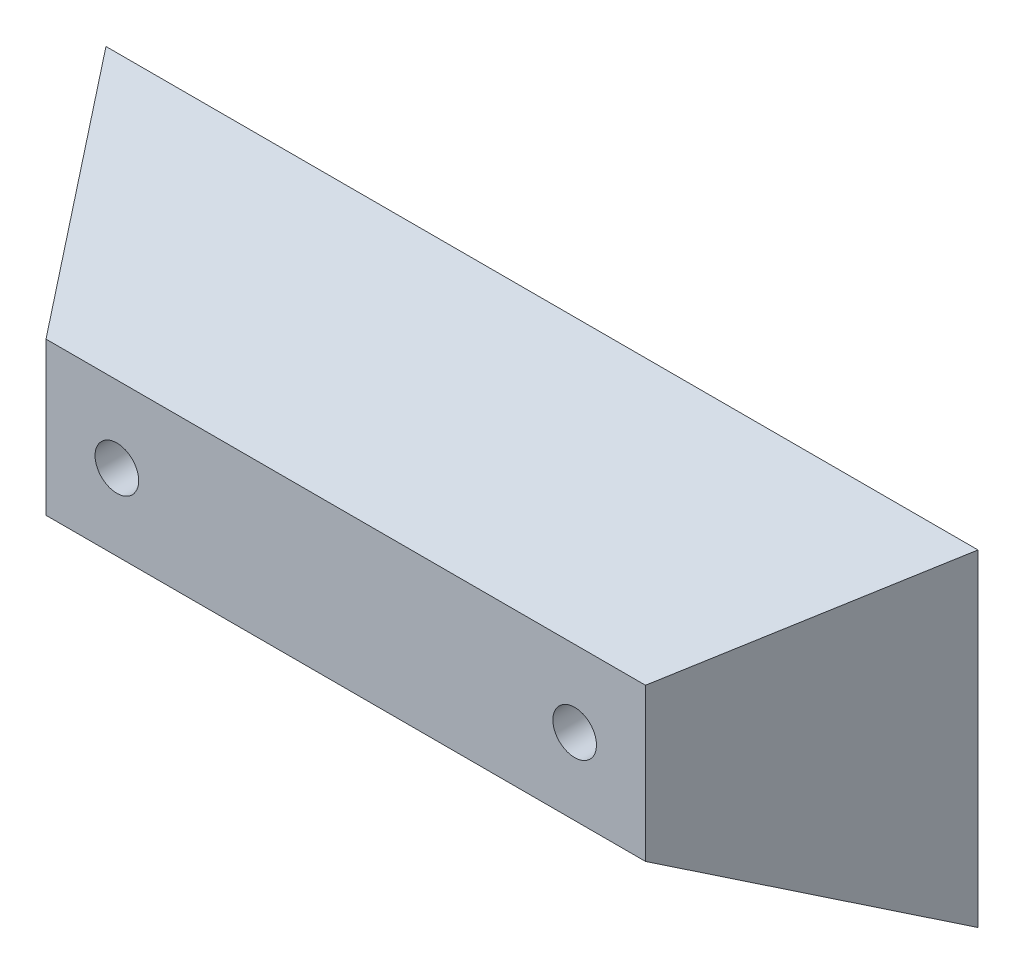
from build123d import *

# Parameters (mm, degrees)
DODANIE_WYCI_GNI_CIE1_DEPTH = 30
WYTNIJ_WYCI_GNI_CIE1_REACH  = 55.141
SZKIC2_R                    = 2
SFAZOWANIE1_SIZE            = 8
SFAZOWANIE1_SIZE_2          = 18
SFAZOWANIE2_SIZE            = 8
SFAZOWANIE2_SIZE_2          = 18


with BuildPart() as part:
    # Szkic1 → Dodanie-wyciągnięcie1 (new body)
    with BuildSketch(Plane(origin=(0, 0, 0), x_dir=(1, 0, 0), z_dir=(0, 1, 0))):
        Polygon((-40, 0), (-27.5, -18), (27.5, -18), (40, 0), align=None)
    extrude(amount=DODANIE_WYCI_GNI_CIE1_DEPTH)

    # Szkic2 → Wytnij-wyciągnięcie1 (cut, up to next)
    with BuildSketch(Plane(origin=(0, 0, 0), x_dir=(-1, 0, 0), z_dir=(0, 0, -1)), mode=Mode.PRIVATE) as wytnij_wyci_gni_cie1_sk1:
        with Locations((-21, 15)):
            Circle(SZKIC2_R)
    wytnij_wyci_gni_cie1_tool1 = extrude(wytnij_wyci_gni_cie1_sk1.sketch, amount=-WYTNIJ_WYCI_GNI_CIE1_REACH, mode=Mode.PRIVATE) & part.part
    # Szkic2 → Wytnij-wyciągnięcie1 (cut, up to next)
    with BuildSketch(Plane(origin=(0, 0, 0), x_dir=(-1, 0, 0), z_dir=(0, 0, -1)), mode=Mode.PRIVATE) as wytnij_wyci_gni_cie1_sk2:
        with Locations((21, 15)):
            Circle(SZKIC2_R)
    wytnij_wyci_gni_cie1_tool2 = extrude(wytnij_wyci_gni_cie1_sk2.sketch, amount=-WYTNIJ_WYCI_GNI_CIE1_REACH, mode=Mode.PRIVATE) & part.part
    add(wytnij_wyci_gni_cie1_tool1.solids().sort_by_distance((21, 15, 0))[0], mode=Mode.SUBTRACT)
    add(wytnij_wyci_gni_cie1_tool2.solids().sort_by_distance((-21, 15, 0))[0], mode=Mode.SUBTRACT)

    # Sfazowanie1
    # the kernel refuses this chamfer: 18, 8 mm, written as the material it takes off along each edge
    with BuildSketch(Plane(origin=(-74.15058918, 0, 18), x_dir=(0, 0.996867139056945, 0.0790942922619672), z_dir=(1, 0, 0))) as sfazowanie1_piece_1:
        Polygon((SFAZOWANIE1_SIZE * 0.996867139057, -SFAZOWANIE1_SIZE * 0.079094292262), (-SFAZOWANIE1_SIZE_2 * 0.079094292262, -SFAZOWANIE1_SIZE_2 * 0.996867139057), (0, 0), align=None)
    extrude(amount=148.301178361, mode=Mode.SUBTRACT)

    # Sfazowanie2
    # the kernel refuses this chamfer: 18, 8 mm, written as the material it takes off along each edge
    with BuildSketch(Plane(origin=(-74.15058918, 30, 18), x_dir=(0, -0.996867139056945, 0.0790942922619672), z_dir=(1, 0, 0))) as sfazowanie2_piece_1:
        Polygon((SFAZOWANIE2_SIZE * 0.996867139057, SFAZOWANIE2_SIZE * 0.079094292262), (-SFAZOWANIE2_SIZE_2 * 0.079094292262, SFAZOWANIE2_SIZE_2 * 0.996867139057), (0, 0), align=None)
    extrude(amount=148.301178361, mode=Mode.SUBTRACT)


solid = part.part
